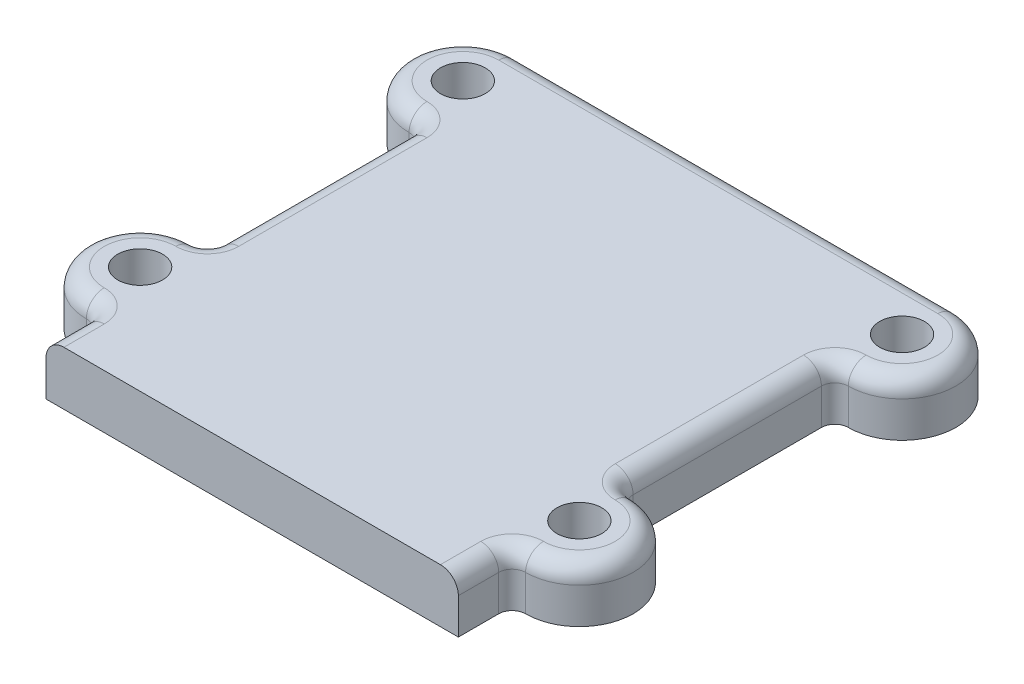
from build123d import *

# Parameters (mm, degrees)
SKETCH3_R           = 1.25
BOSS_EXTRUDE1_DEPTH = 3
FILLET1_R           = 0.75
FILLET2_R           = 1


with BuildPart() as part:
    # Sketch3 → Boss-Extrude1 (new body)
    with BuildSketch(Plane(origin=(0, 0, 0), x_dir=(1, 0, 0), z_dir=(0, 1, 0))):
        with BuildLine():
            Line((-11.5, -24), (-11.5, -27))
            Line((-11.5, -27), (11.5, -27))
            Line((11.5, -27), (11.5, -24))
            Line((11.5, -24), (12.25, -24))
            ThreePointArc((12.25, -24), (15.25, -21), (12.25, -18))
            Line((12.25, -18), (11.5, -18))
            Line((11.5, -18), (11.5, -6))
            Line((11.5, -6), (12.25, -6))
            ThreePointArc((12.25, -6), (15.25, -3), (12.25, 0))
            Line((12.25, 0), (-12.25, 0))
            ThreePointArc((-12.25, 0), (-15.25, -3), (-12.25, -6))
            Line((-12.25, -6), (-11.5, -6))
            Line((-11.5, -6), (-11.5, -18))
            Line((-11.5, -18), (-12.25, -18))
            ThreePointArc((-12.25, -18), (-15.25, -21), (-12.25, -24))
            Line((-12.25, -24), (-11.5, -24))
        make_face()
        with Locations(Location((-12.25, -21, 0), (0, 0, 90))):
            Circle(SKETCH3_R, mode=Mode.SUBTRACT)
        with Locations(Location((-12.25, -3, 0), (0, 0, 90))):
            Circle(SKETCH3_R, mode=Mode.SUBTRACT)
        with Locations(Location((12.25, -3, 0), (0, 0, 270))):
            Circle(SKETCH3_R, mode=Mode.SUBTRACT)
        with Locations(Location((12.25, -21, 0), (0, 0, 270))):
            Circle(SKETCH3_R, mode=Mode.SUBTRACT)
    extrude(amount=BOSS_EXTRUDE1_DEPTH)

    # Fillet1
    fillet1_edges = [part.edges().sort_by_distance(p)[0] for p in [
        (-11.5, 1.5, 18),
        (-11.5, 1.5, 24),
        (-11.5, 1.5, 6),
        (11.5, 1.5, 6),
        (11.5, 1.5, 24),
        (11.5, 1.5, 18),
    ]]
    fillet(fillet1_edges, radius=FILLET1_R - 0.0001)  # a hair under: the kernel refuses the full size

    # Fillet2
    fillet2_edges = [part.edges().sort_by_distance(p)[0] for p in [
        (15.25, 3, 21),
        (15.25, 3, 3),
        (0, 3, 0),
        (-15.25, 3, 3),
        (-15.25, 3, 21),
        (-11.5, 3, 12),
        (-11.5, 3, 25.87495),
        (11.5, 3, 12),
        (-11.719640625, 3, 17.780359375),
        (-11.719640625, 3, 24.219640625),
        (-11.719640625, 3, 6.219640625),
        (11.719640625, 3, 6.219640625),
        (11.719640625, 3, 24.219640625),
        (11.719640625, 3, 17.780359375),
        (11.5, 3, 25.87495),
    ]]
    fillet(fillet2_edges, radius=FILLET2_R)


solid = part.part
